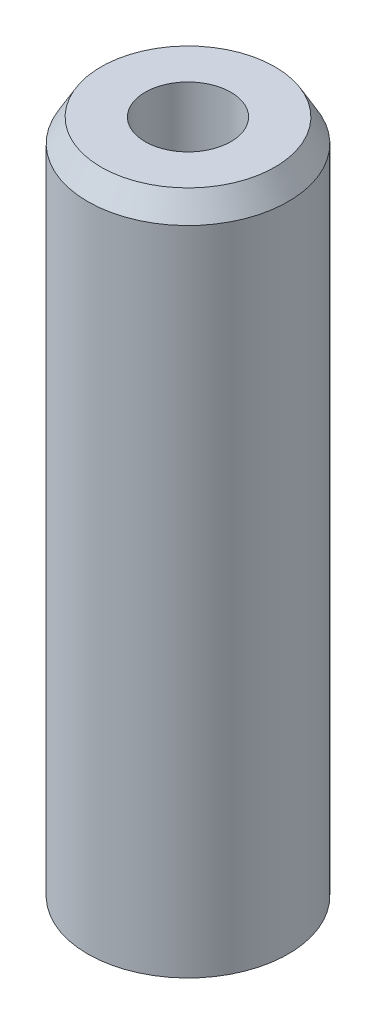
from build123d import *
from OCP.BRepFilletAPI import BRepFilletAPI_MakeChamfer

# Parameters (mm, degrees)
SKETCH1_R           = 10
BOSS_EXTRUDE1_DEPTH = 68.609891282
SKETCH2_R           = 4.275276014
CUT_EXTRUDE1_DEPTH  = 71.052246086
CHAMFER1_SIZE       = 2.308164311
CHAMFER1_SIZE2      = 1.332619286


with BuildPart() as part:
    # Sketch1 → Boss-Extrude1 (new body)
    with BuildSketch(Plane(origin=(0, 0, 0), x_dir=(1, 0, 0), z_dir=(0, 1, 0))):
        Circle(SKETCH1_R)
    extrude(amount=BOSS_EXTRUDE1_DEPTH)

    # Sketch2 → Cut-Extrude1 (cut, through all)
    with BuildSketch(Plane(origin=(0, 0, 0), x_dir=(1, 0, 0), z_dir=(0, 1, 0))):
        Circle(SKETCH2_R)
    extrude(amount=CUT_EXTRUDE1_DEPTH, mode=Mode.SUBTRACT)

    # Chamfer1: one chamfer whose edges measure the first distance from different faces: ONE call of the kernel's chamfer builder (chamfer() names one face for all edges)
    chamfer1_edges_1 = [part.edges().sort_by_distance(p)[0] for p in [
        (-10, 68.609891282, 0),
    ]]
    chamfer1_side_1 = [part.faces().sort_by_distance(p)[0] for p in [
        (-10, 34.304945641, 0),
    ]]
    chamfer1_edges_2 = [part.edges().sort_by_distance(p)[0] for p in [
        (-10, 0, 0),
    ]]
    chamfer1_side_2 = [part.faces().sort_by_distance(p)[0] for p in [
        (-9.717157288, 0, 0),
    ]]
    chamfer1 = BRepFilletAPI_MakeChamfer(part.part.solid().wrapped)
    for e in chamfer1_edges_1:
        chamfer1.Add(CHAMFER1_SIZE, CHAMFER1_SIZE2, e.wrapped, chamfer1_side_1[0].wrapped)  # the first distance lies on this face
    for e in chamfer1_edges_2:
        chamfer1.Add(CHAMFER1_SIZE, CHAMFER1_SIZE2, e.wrapped, chamfer1_side_2[0].wrapped)  # the first distance lies on this face
    add(Compound.cast(chamfer1.Shape()), mode=Mode.REPLACE)


solid = part.part
